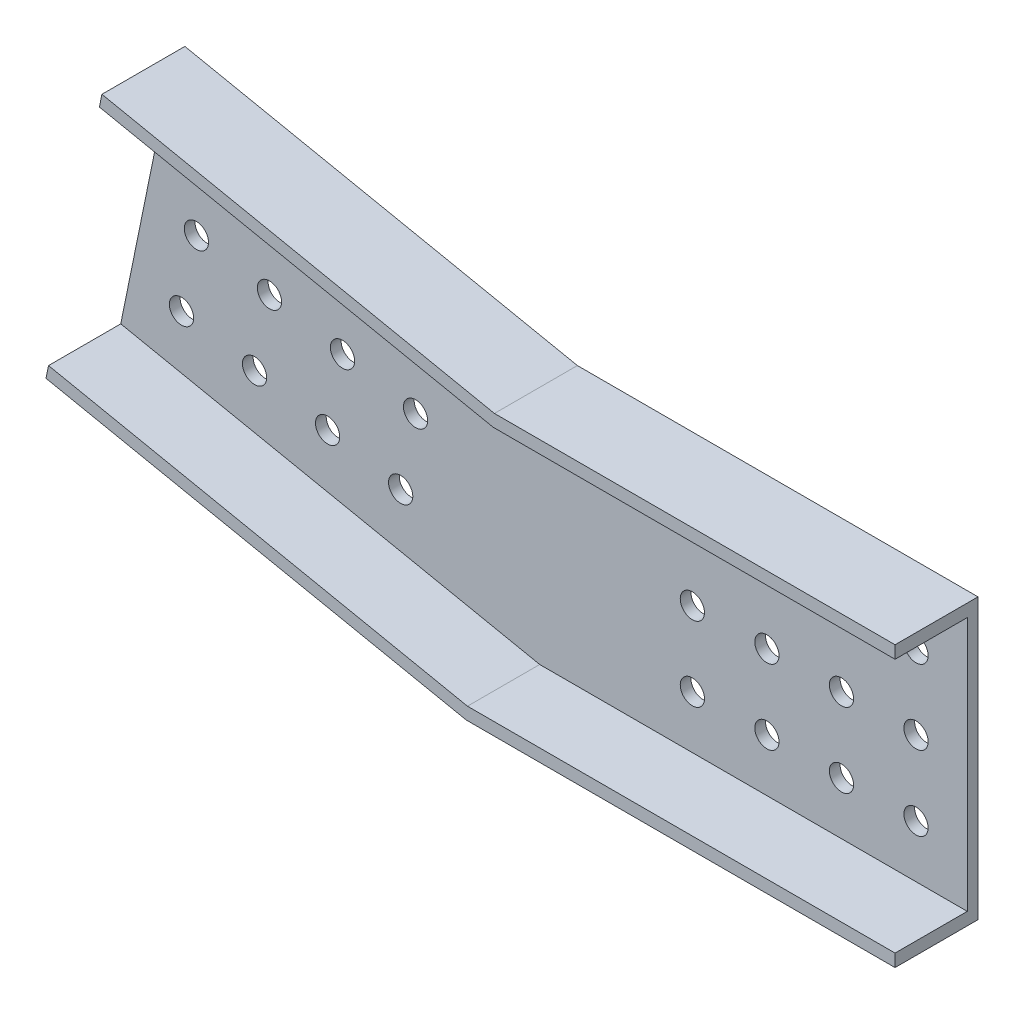
from build123d import *

# Parameters (mm, degrees)
EXTRUDE_1_DEPTH             = 89
CUT_EXTRUDE_1_DEPTH         = 77.5
SKETCH_4_R                  = 13
CUT_EXTRUDE_2_DEPTH         = 530.874608663
PATTERN_LINEAR_1_COUNT      = 4
PATTERN_LINEAR_1_PITCH      = 80
PATTERN_LINEAR_1_COUNT_DIR2 = 3
PATTERN_LINEAR_1_PITCH_DIR2 = 80
SKETCH_5_R                  = 13
CUT_EXTRUDE_3_DEPTH         = 530.874608663
PATTERN_LINEAR_2_COUNT      = 4
PATTERN_LINEAR_2_PITCH      = 80
PATTERN_LINEAR_2_COUNT_DIR2 = 3
PATTERN_LINEAR_2_PITCH_DIR2 = 80


with BuildPart() as part:
    # 草图2 → 凸台-拉伸1 (new body)
    with BuildSketch(Plane.XY):
        Polygon((15.153077165, 150), (445, 150), (445, -150), (-15.153077165, -150), (-466.009174215, -57.969384567), (-406.009174215, 235.969384567), align=None)
    extrude(amount=EXTRUDE_1_DEPTH)

    # 草图3 → 切除-拉伸1 (cut)
    with BuildSketch(Plane.XY.offset(89)):
        Polygon((-408.709174215, 222.742139956), (13.78930022, 136.5), (445, 136.5), (445, -136.5), (-13.78930022, -136.5), (-463.309174215, -44.742139956), align=None)
    extrude(amount=-CUT_EXTRUDE_1_DEPTH, mode=Mode.SUBTRACT)

    # 草图4 → 切除-拉伸2 (cut, through all)
    with BuildSketch(Plane(origin=(0, 0, 0), x_dir=(-1, 0, 0), z_dir=(0, 0, -1))):
        with Locations((-390, 80)):
            Circle(SKETCH_4_R)
    cut_extrude_2 = extrude(amount=-CUT_EXTRUDE_2_DEPTH, mode=Mode.SUBTRACT)

    # 阵列(线性)1: Cut-Extrude 2 4 × 3
    with Locations(*[(-i * PATTERN_LINEAR_1_PITCH, -j * PATTERN_LINEAR_1_PITCH_DIR2, 0) for i in range(PATTERN_LINEAR_1_COUNT) for j in range(PATTERN_LINEAR_1_COUNT_DIR2) if (i, j) != (0, 0)]):
        add(cut_extrude_2, mode=Mode.SUBTRACT)

    # 草图5 → 切除-拉伸3 (cut, through all)
    with BuildSketch(Plane(origin=(0, 0, 0), x_dir=(-1, 0, 0), z_dir=(0, 0, -1))):
        with Locations((366.120399874, 156.383671769)):
            Circle(SKETCH_5_R)
    cut_extrude_3 = extrude(amount=-CUT_EXTRUDE_3_DEPTH, mode=Mode.SUBTRACT)

    # 阵列(线性)2: Cut-Extrude 3 4 × 3
    with Locations(*[Vector(0.9797958971132712, -0.2000000000000001, 0) * (i * PATTERN_LINEAR_2_PITCH) + Vector(-0.19999999999999998, -0.9797958971132713, 0) * (j * PATTERN_LINEAR_2_PITCH_DIR2) for i in range(PATTERN_LINEAR_2_COUNT) for j in range(PATTERN_LINEAR_2_COUNT_DIR2) if (i, j) != (0, 0)]):
        add(cut_extrude_3, mode=Mode.SUBTRACT)


solid = part.part
